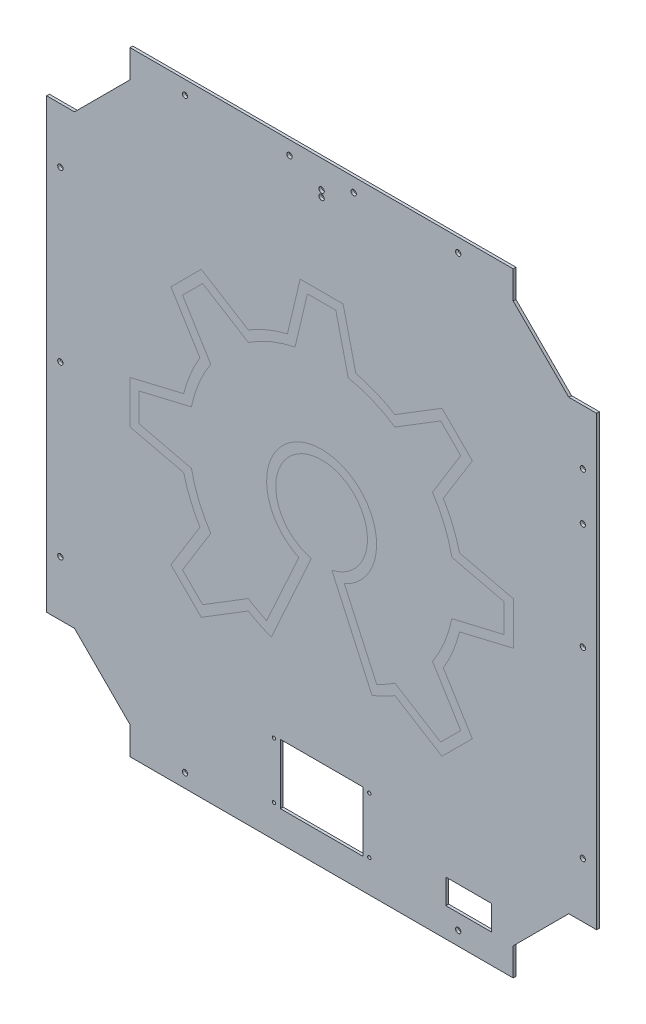
from build123d import *

# Parameters (mm, degrees)
SKETCH1_W            = 600
SKETCH1_H            = 670
BOSS_EXTRUDE1_DEPTH  = 1.5
CUT_EXTRUDE1_DEPTH   = 450.704347322
M5_CLEARANCE_HOLE1_D = 5.8
M5_CLEARANCE_HOLE2_D = 5.8
SKETCH7_W            = 90
SKETCH7_H            = 65.5
CUT_EXTRUDE2_DEPTH   = 450.704347322
M3_CLEARANCE_HOLE1_D = 3.6
SKETCH11_W           = 50
SKETCH11_H           = 27
CUT_EXTRUDE3_DEPTH   = 450.704347322


with BuildPart() as part:
    # Sketch1 → Boss-Extrude1 (new, symmetric)
    with BuildSketch(Plane.XY):
        Rectangle(SKETCH1_W, SKETCH1_H)
    extrude(amount=BOSS_EXTRUDE1_DEPTH, both=True)

    # Sketch2 → Cut-Extrude1 (cut, through all)
    with BuildSketch(Plane.XY.offset(1.5)):
        Polygon((-269.585786438, 244), (-209, 304.585786438), (-209, 335), (-300, 335), (-300, 244), align=None)
        Polygon((300, 335), (209, 335), (209, 304.585786438), (269.585786438, 244), (300, 244), align=None)
        Polygon((300, -335), (209, -335), (209, -304.585786438), (269.585786438, -244), (300, -244), align=None)
        Polygon((-300, -335), (-209, -335), (-209, -304.585786438), (-269.585786438, -244), (-300, -244), align=None)
    extrude(amount=-CUT_EXTRUDE1_DEPTH, mode=Mode.SUBTRACT)

    # M5 Clearance Hole1 (through all)
    with Locations(Plane.XY.offset(1.5)):
        with Locations((-149, 320), (149, 320), (-285, 184), (-285, 0), (-285, -184), (285, -184), (285, 15.545024027), (285, 184), (149, -320), (-149, -320), (285, 132)):
            Hole(M5_CLEARANCE_HOLE1_D / 2)

    # M5 Clearance Hole2 (through all)
    with Locations(Plane.XY.offset(1.5)):
        with Locations((-35, 320), (35, 320), (0, 305), (0, 298)):
            Hole(M5_CLEARANCE_HOLE2_D / 2)

    # Sketch7 → Cut-Extrude2 (cut, through all)
    with BuildSketch(Plane.XY.offset(1.5)):
        with Locations((0, -269.25)):
            Rectangle(SKETCH7_W, SKETCH7_H)
    extrude(amount=-CUT_EXTRUDE2_DEPTH, mode=Mode.SUBTRACT)

    # M3 Clearance Hole1 (through all)
    with Locations(Plane(origin=(0, 0, -1.5), x_dir=(-1, 0, 0), z_dir=(0, 0, -1))):
        with Locations((-52, -238.75), (52, -238.75), (-52, -299.75), (52, -299.75)):
            Hole(M3_CLEARANCE_HOLE1_D / 2)

    # Sketch11 → Cut-Extrude3 (cut, through all)
    with BuildSketch(Plane.XY.offset(1.5)):
        with Locations((160.5, -289.9)):
            Rectangle(SKETCH11_W, SKETCH11_H)
    extrude(amount=-CUT_EXTRUDE3_DEPTH, mode=Mode.SUBTRACT)


solid = part.part
